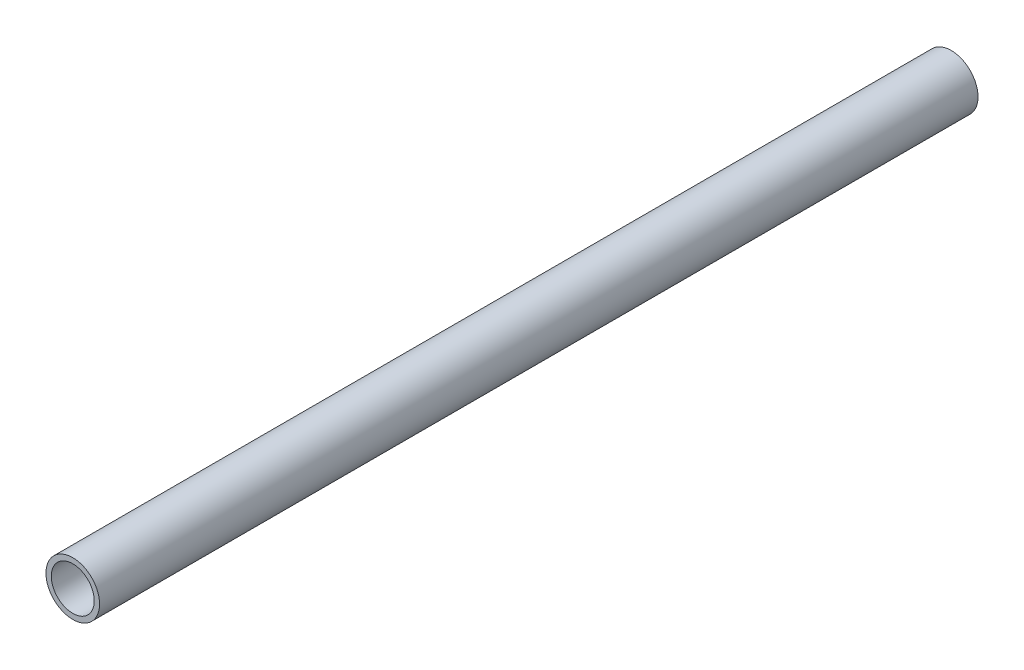
from build123d import *

# Parameters (mm, degrees)
SKETCH1_R           = 5.05
SKETCH1_R_2         = 4.05
EXTRUDE_THIN1_DEPTH = 165.5


with BuildPart() as part:
    # Sketch1 → Extrude-Thin1 (new body)
    with BuildSketch(Plane.XY):
        Circle(SKETCH1_R)
        Circle(SKETCH1_R_2, mode=Mode.SUBTRACT)
    extrude(amount=EXTRUDE_THIN1_DEPTH)


solid = part.part
